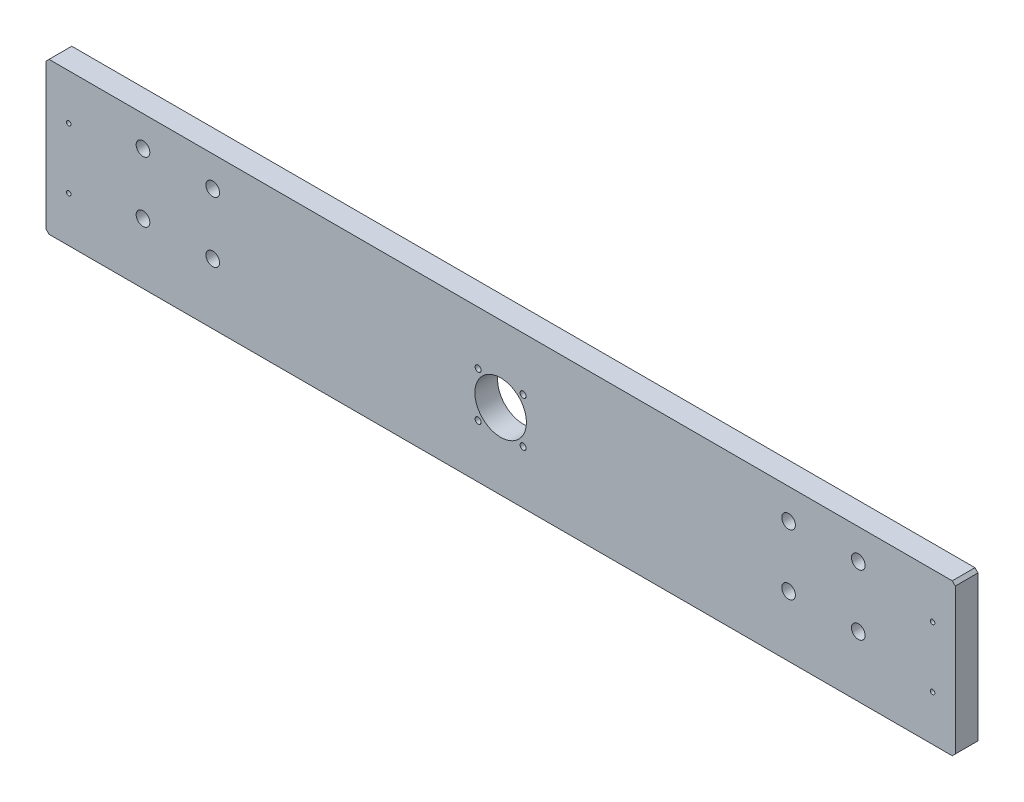
from build123d import *

# Parameters (mm, degrees)
SCHIZZO1_R                   = 17
SCHIZZO1_R_2                 = 2
SCHIZZO1_R_3                 = 4.5
SCHIZZO1_R_4                 = 1.5
ESTRUSIONE_ESTRUSIONE1_DEPTH = 15
M8_TAPPED_HOLE1_D            = 6.8
M8_TAPPED_HOLE1_DEPTH        = 23.75
M8_TAPPED_HOLE1_TIP          = 2.042926105


with BuildPart() as part:
    # Schizzo1 → Estrusione-Estrusione1 (new body)
    with BuildSketch(Plane.XY):
        Polygon((2, 0), (598, 0), (600, 2), (600, 98), (598, 100), (2, 100), (0, 98), (0, 2), align=None)
        with Locations((300, 50)):
            Circle(SCHIZZO1_R, mode=Mode.SUBTRACT)
        with Locations((314.849242405, 64.849242405)):
            Circle(SCHIZZO1_R_2, mode=Mode.SUBTRACT)
        with Locations((110, 40)):
            Circle(SCHIZZO1_R_3, mode=Mode.SUBTRACT)
        with Locations((314.849242405, 35.150757595)):
            Circle(SCHIZZO1_R_2, mode=Mode.SUBTRACT)
        with Locations((285.150757595, 35.150757595)):
            Circle(SCHIZZO1_R_2, mode=Mode.SUBTRACT)
        with Locations((110, 80)):
            Circle(SCHIZZO1_R_3, mode=Mode.SUBTRACT)
        with Locations((536, 40)):
            Circle(SCHIZZO1_R_3, mode=Mode.SUBTRACT)
        with Locations((64, 40)):
            Circle(SCHIZZO1_R_3, mode=Mode.SUBTRACT)
        with Locations((64, 80)):
            Circle(SCHIZZO1_R_3, mode=Mode.SUBTRACT)
        with Locations((490, 40)):
            Circle(SCHIZZO1_R_3, mode=Mode.SUBTRACT)
        with Locations((15, 30)):
            Circle(SCHIZZO1_R_4, mode=Mode.SUBTRACT)
        with Locations((585, 30)):
            Circle(SCHIZZO1_R_4, mode=Mode.SUBTRACT)
        with Locations((285.150757595, 64.849242405)):
            Circle(SCHIZZO1_R_2, mode=Mode.SUBTRACT)
        with Locations((490, 80)):
            Circle(SCHIZZO1_R_3, mode=Mode.SUBTRACT)
        with Locations((536, 80)):
            Circle(SCHIZZO1_R_3, mode=Mode.SUBTRACT)
        with Locations((585, 70)):
            Circle(SCHIZZO1_R_4, mode=Mode.SUBTRACT)
        with Locations((15, 70)):
            Circle(SCHIZZO1_R_4, mode=Mode.SUBTRACT)
    extrude(amount=-ESTRUSIONE_ESTRUSIONE1_DEPTH)

    # M8 Tapped Hole1
    with Locations(Plane(origin=(30, 0, -7.5), x_dir=(0, 0, -1), z_dir=(0, -1, 0))):
        with Locations((0, 0), (0, 540)):
            Hole(M8_TAPPED_HOLE1_D / 2, depth=M8_TAPPED_HOLE1_DEPTH)
            with Locations((0, 0, -(M8_TAPPED_HOLE1_DEPTH + M8_TAPPED_HOLE1_TIP / 2))):  # 118° drill point
                Cone(0, M8_TAPPED_HOLE1_D / 2, M8_TAPPED_HOLE1_TIP, mode=Mode.SUBTRACT)


solid = part.part
